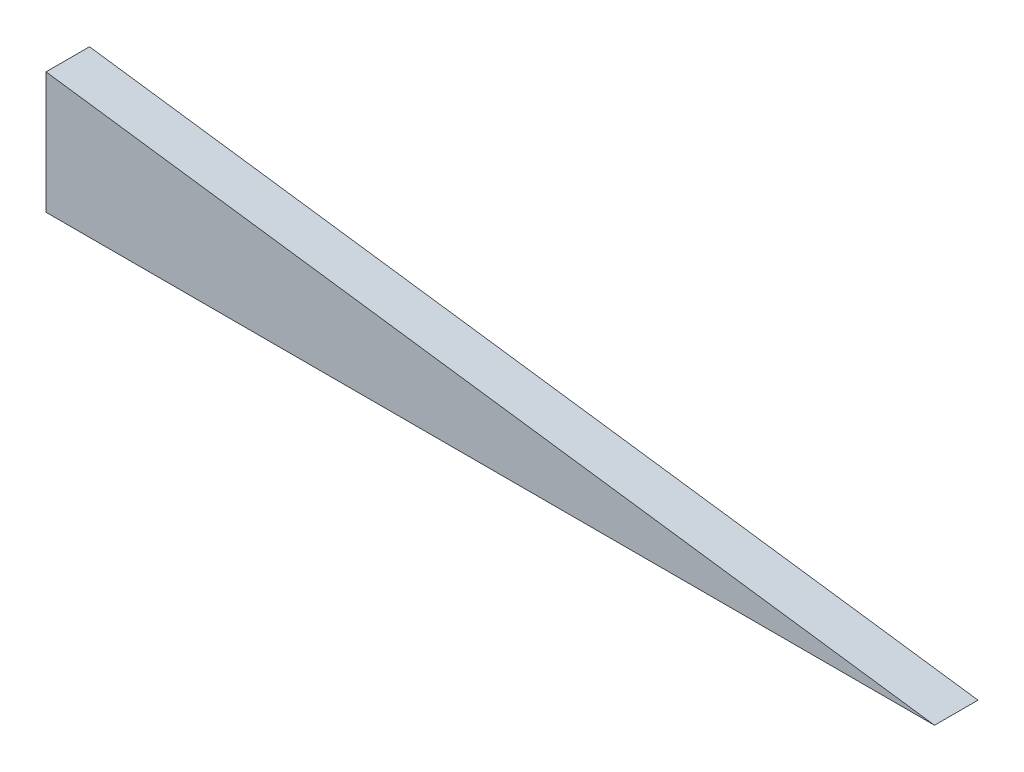
from build123d import *

# Parameters (mm, degrees)
BOSS_EXTRUDE1_DEPTH = 2.667


with BuildPart() as part:
    # Sketch1 → Boss-Extrude1 (new, symmetric)
    with BuildSketch(Plane.XY):
        Polygon((0, 0), (-108.966, 0), (-108.966, 14.914796948), align=None)
    extrude(amount=BOSS_EXTRUDE1_DEPTH, both=True)


solid = part.part
